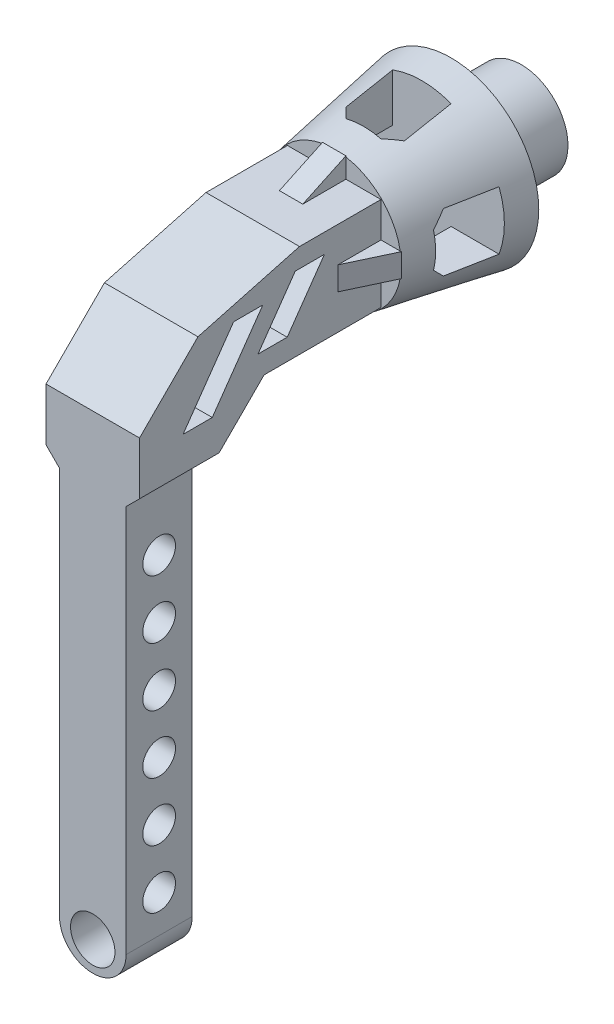
from build123d import *

# Parameters (mm, degrees)
SKETCH_1_R               = 4
SKETCH_1_R_2             = 2.5
EXTRUDE_1_DEPTH          = 6
SKETCH_2_R               = 7.5
EXTRUDE_2_DEPTH          = 10
EXTRUDE_2_TAPER          = 10
CHAMFER_1_SIZE           = 1
SWEEP_1_PITCH            = 0.8
SWEEP_1_FROM             = 0
SKETCH_7_W               = 8
SKETCH_7_H               = 8
EXTRUDE_5_DEPTH          = 10
EXTRUDE_6_DEPTH          = 8
SKETCH_13_W              = 8
SKETCH_13_H              = 8
EXTRUDE_7_DEPTH          = 7.07
EXTRUDE_8_DEPTH          = 8
SKETCH_16_W              = 5.7
SKETCH_16_H              = 5.656854249
EXTRUDE_9_DEPTH          = 31
SKETCH_17_W              = 5.7
SKETCH_17_H              = 5
SKETCH_17_R              = 1.9
EXTRUDE_10_DEPTH         = 5.656854249
FILLET_1_R               = 2.8
CUT_EXTRUDE_2_DEPTH      = 60.167995179
CHAMFER_2_SIZE           = 1.15
EXTRUDE_11_DEPTH         = 1
EXTRUDE_11_DEPTH_BACK    = 1
EXTRUDE_12_DEPTH         = 1
EXTRUDE_12_DEPTH_BACK    = 1
CUT_EXTRUDE_3_DEPTH      = 10
CUT_EXTRUDE_3_DEPTH_BACK = 10
SKETCH_21_W              = 5
SKETCH_21_H              = 5
CUT_EXTRUDE_4_DEPTH      = 10
CUT_EXTRUDE_4_DEPTH_BACK = 10
SKETCH_22_W              = 5
SKETCH_22_H              = 5
CHAMFER_4_SIZE           = 1
SKETCH_23_R              = 2.5
CUT_EXTRUDE_5_DEPTH      = 2
CHAMFER_5_SIZE           = 2
CUT_EXTRUDE_8_DEPTH      = 10
SKETCH_26_R              = 1.4
CUT_EXTRUDE_9_DEPTH      = 10


with BuildPart() as part:
    # 草图1 → 凸台-拉伸1 (new body)
    with BuildSketch(Plane.XY):
        Circle(SKETCH_1_R)
        Circle(SKETCH_1_R_2, mode=Mode.SUBTRACT)
    extrude(amount=EXTRUDE_1_DEPTH)

    # 草图2 → 凸台-拉伸2 (add)
    with BuildSketch(Plane.XY.offset(6)):
        Circle(SKETCH_2_R)
    extrude(amount=EXTRUDE_2_DEPTH, taper=EXTRUDE_2_TAPER)

    # 倒角1
    chamfer_1_edges = [part.edges().sort_by_distance(p)[0] for p in [
        (-2.5, 0, 0),
    ]]
    chamfer(chamfer_1_edges, length=CHAMFER_1_SIZE)

    # 切除-扫描1: arcs per turn and ends read off the stored shape
    # 切除-扫描1: the profile of 草图6 screwed along a left-hand helix through 8 turns, 8 arcs to a turn; built about Z, then put on its axis
    sweep_1_z = Axis((0, 0, 0), (0, 0, 1))
    sweep_1_corners = [(2.513437751, 0.010149744, -0.600710237), (2.486562249, -0.010149744, -0.999289763), (2.845627372, -0.001183845, -0.823244741)]
    with BuildLine(mode=Mode.PRIVATE) as sweep_1_profile:
        Line(sweep_1_corners[0], sweep_1_corners[1])
        Line(sweep_1_corners[1], sweep_1_corners[2])
        Line(sweep_1_corners[2], sweep_1_corners[0])
    sweep_1_cap = Face(sweep_1_profile.wire())
    sweep_1_turn_angles = [0, -22.5, -45, -67.5, -90, -112.5, -135, -157.5, -180, -202.5, -225, -247.5, -270, -292.5, -315, -337.5, -360]
    sweep_1_turn_weights = [1, 0.9238795325112867, 1, 0.9238795325112867, 1, 0.9238795325112867, 1, 0.9238795325112867, 1, 0.9238795325112867, 1, 0.9238795325112867, 1, 0.9238795325112867, 1, 0.9238795325112867, 1]
    sweep_1_turn_rails = [Edge.make_bspline([Vector(p[0], p[1], 0).rotate(sweep_1_z, sweep_1_turn_angles[k]) / sweep_1_turn_weights[k] + Vector(0, 0, p[2] + -SWEEP_1_PITCH * sweep_1_turn_angles[k] / 360) for k in range(17)], [0, 0, 0, 1, 1, 2, 2, 3, 3, 4, 4, 5, 5, 6, 6, 7, 7, 8, 8, 8], 2, sweep_1_turn_weights) for p in sweep_1_corners]
    sweep_1_turn_sides = [Face.make_surface_from_curves(sweep_1_turn_rails[p[0]], sweep_1_turn_rails[p[1]]) for p in [(0, 1), (1, 2), (2, 0)]]
    sweep_1 = Plane(origin=(0, 0, 6), x_dir=(0.7071067811865512, 0.7071067811865438, 0), z_dir=(0, 0, -1)) * split(Solid(Shell([*[p.moved(Location((0, 0, SWEEP_1_PITCH * i))) for i in range(8) for p in sweep_1_turn_sides], sweep_1_cap, sweep_1_cap.rotate(sweep_1_z, -2880).moved(Location((0, 0, -SWEEP_1_PITCH * -2880 / 360)))])), bisect_by=Plane.XY.offset(SWEEP_1_FROM), keep=Keep.TOP, mode=Mode.PRIVATE)
    add(sweep_1, mode=Mode.SUBTRACT)

    # 草图7 → 凸台-拉伸5 (add)
    with BuildSketch(Plane.XY.offset(16)):
        Rectangle(SKETCH_7_W, SKETCH_7_H)
    extrude(amount=EXTRUDE_5_DEPTH)

    # 草图12 → 凸台-拉伸6 (add)
    with BuildSketch(Plane.ZY.offset(4)):
        Polygon((26, 4), (26, -4), (34, 4), align=None)
    extrude(amount=-EXTRUDE_6_DEPTH)

    # 草图13 → 凸台-拉伸7 (add)
    with BuildSketch(Plane(origin=(0, -15, 15), x_dir=(1, 0, 0), z_dir=(0, -0.7071067811865693, 0.7071067811865258))):
        with Locations((0, 19.556349186)):
            Rectangle(SKETCH_13_W, SKETCH_13_H)
    extrude(amount=EXTRUDE_7_DEPTH)

    # 草图15 → 凸台-拉伸8 (add)
    with BuildSketch(Plane.ZY.offset(4)):
        Polygon((36.656099192, -3.342390693), (36.656099192, -8.999244943), (30.999244943, -8.999244943), align=None)
    extrude(amount=-EXTRUDE_8_DEPTH)

    # 草图16 → 凸台-拉伸9 (add)
    with BuildSketch(Plane.XZ.offset(8.999244943)):
        with Locations((0, 33.827672068)):
            Rectangle(SKETCH_16_W, SKETCH_16_H)
    extrude(amount=EXTRUDE_9_DEPTH)

    # 草图17 → 凸台-拉伸10 (add)
    with BuildSketch(Plane(origin=(0, 0, 30.999244943), x_dir=(-1, 0, 0), z_dir=(0, 0, -1))):
        with Locations((0, -42.499244943)):
            Rectangle(SKETCH_17_W, SKETCH_17_H)
        with Locations((0, -42.499244943)):
            Circle(SKETCH_17_R, mode=Mode.SUBTRACT)
    extrude(amount=-EXTRUDE_10_DEPTH)

    # 圆角1
    fillet_1_edges = [part.edges().sort_by_distance(p)[0] for p in [
        (-2.85, -44.999244943, 33.827672067),
        (2.85, -44.999244943, 33.827672067),
    ]]
    fillet(fillet_1_edges, radius=FILLET_1_R)

    # 草图18 → 切除-拉伸2 (cut, through all)
    with BuildSketch(Plane(origin=(4, 0, 0), x_dir=(0, 0, -1), z_dir=(1, 0, 0))):
        Polygon((-31.656854249, 1.656854249), (-22.968781508, 4), (-34, 4), align=None)
    extrude(amount=-CUT_EXTRUDE_2_DEPTH, mode=Mode.SUBTRACT)

    # 倒角2
    chamfer_2_edges = [part.edges().sort_by_distance(p)[0] for p in [
        (4, -8.999244943, 33.827672068),
        (-4, -8.999244943, 33.827672068),
    ]]
    chamfer(chamfer_2_edges, length=CHAMFER_2_SIZE - 0.0001)  # a hair under: the kernel refuses the full size

    # 草图19 → 凸台-拉伸11 (add, two sides: drawn at the far end of the back side and taken through both)
    with BuildSketch(Plane(origin=(0, 0, 0), x_dir=(1, 0, 0), z_dir=(0, 1, 0)).offset(-EXTRUDE_11_DEPTH_BACK)):
        Polygon((-5.736730193, -16), (-4, -19.690245422), (-4, -16), align=None)
        Polygon((4, -16), (4, -19.690245422), (5.736730193, -16), align=None)
    extrude(amount=EXTRUDE_11_DEPTH + EXTRUDE_11_DEPTH_BACK)

    # 草图20 → 凸台-拉伸12 (add, two sides: drawn at the far end of the back side and taken through both)
    with BuildSketch(Plane(origin=(0, 0, 0), x_dir=(0, 0, -1), z_dir=(1, 0, 0)).offset(-EXTRUDE_12_DEPTH_BACK)):
        Polygon((-19.690245422, -4), (-16, -5.736730193), (-16, -4), align=None)
        Polygon((-19.690245422, 4), (-16, 5.736730193), (-16, 4), align=None)
    extrude(amount=EXTRUDE_12_DEPTH + EXTRUDE_12_DEPTH_BACK)

    # 草图21 → 切除-拉伸3 (cut, two sides: drawn at the far end of the back side and taken through both)
    with BuildSketch(Plane(origin=(0, 0, 0), x_dir=(1, 0, 0), z_dir=(0, 1, 0)).offset(-CUT_EXTRUDE_3_DEPTH_BACK)):
        with Locations((0, -11)):
            Rectangle(SKETCH_21_W, SKETCH_21_H)
    extrude(amount=CUT_EXTRUDE_3_DEPTH + CUT_EXTRUDE_3_DEPTH_BACK, mode=Mode.SUBTRACT)

    # 草图22 → 切除-拉伸4 (cut, two sides: drawn at the far end of the back side and taken through both)
    with BuildSketch(Plane(origin=(0, 0, 0), x_dir=(0, 0, -1), z_dir=(1, 0, 0)).offset(-CUT_EXTRUDE_4_DEPTH_BACK)):
        with Locations((-11, 0)):
            Rectangle(SKETCH_22_W, SKETCH_22_H)
    extrude(amount=CUT_EXTRUDE_4_DEPTH + CUT_EXTRUDE_4_DEPTH_BACK, mode=Mode.SUBTRACT)

    # 倒角4
    chamfer_4_edges = [part.edges().sort_by_distance(p)[0] for p in [
        (2.5, -4.07453956, 13.5),
        (4.07453956, -2.5, 13.5),
        (4.07453956, 2.5, 13.5),
        (2.5, 4.07453956, 13.5),
        (-2.5, 4.07453956, 13.5),
        (-4.07453956, 2.5, 13.5),
        (-2.5, -4.07453956, 13.5),
        (-4.07453956, -2.5, 13.5),
    ]]
    chamfer(chamfer_4_edges, length=CHAMFER_4_SIZE)

    # 草图23 → 切除-拉伸5 (cut)
    with BuildSketch(Plane(origin=(0, 0, 6), x_dir=(-1, 0, 0), z_dir=(0, 0, -1))):
        Circle(SKETCH_23_R)
    extrude(amount=-CUT_EXTRUDE_5_DEPTH, mode=Mode.SUBTRACT)

    # 倒角5
    chamfer_5_edges = [part.edges().sort_by_distance(p)[0] for p in [
        (2.5, 0, 8),
    ]]
    chamfer(chamfer_5_edges, length=CHAMFER_5_SIZE - 0.0001)  # a hair under: the kernel refuses the full size

    # 草图24 → 切除-拉伸8 (cut)
    with BuildSketch(Plane.ZY.offset(4)):
        Polygon((20.835658318, 2.354970057), (23.335658318, 2.354970057), (26.520454052, -2.193389623), (24.020454052, -2.193389623), align=None)
        Polygon((26.109320936, 1.238278992), (28.609320936, 1.238278992), (32.932432296, -4.93576388), (30.432432296, -4.93576388), align=None)
    extrude(amount=-CUT_EXTRUDE_8_DEPTH, mode=Mode.SUBTRACT)

    # 草图26 → 切除-拉伸9 (cut)
    with BuildSketch(Plane(origin=(2.85, 0, 0), x_dir=(0, 0, -1), z_dir=(1, 0, 0))):
        with Locations((-33.827672068, -13.999244943)):
            Circle(SKETCH_26_R)
        with Locations((-33.827672068, -18.999244943)):
            Circle(SKETCH_26_R)
        with Locations((-33.827672068, -23.999244943)):
            Circle(SKETCH_26_R)
        with Locations((-33.827672068, -28.999244943)):
            Circle(SKETCH_26_R)
        with Locations((-33.827672068, -33.999244943)):
            Circle(SKETCH_26_R)
        with Locations((-33.827672068, -38.999244943)):
            Circle(SKETCH_26_R)
    extrude(amount=-CUT_EXTRUDE_9_DEPTH, mode=Mode.SUBTRACT)


solid = part.part
